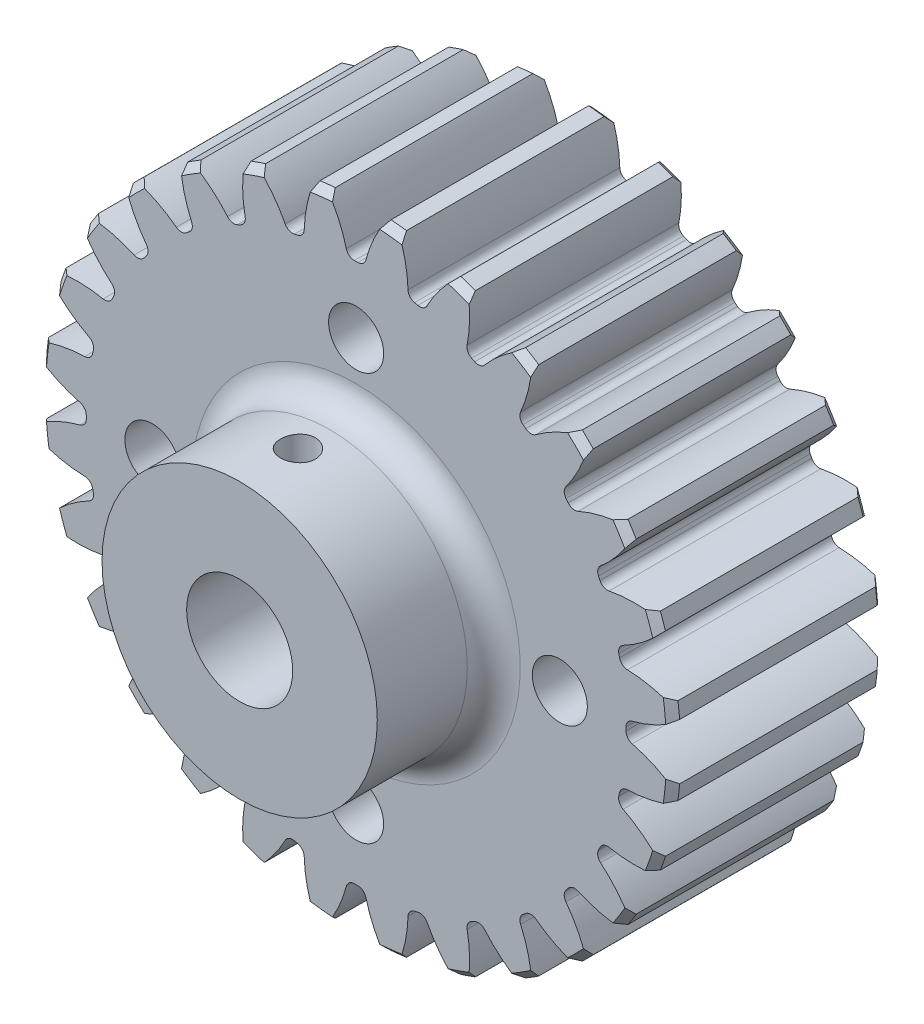
from build123d import *

# Parameters (mm, degrees)
BOSS_EXTRUDE1_DEPTH      = 16
BOSS_EXTRUDE1_DEPTH_BACK = 20
SKETCH3_R                = 30
SKETCH5_W                = 16
SKETCH5_H                = 7.5
SKETCH5_W_2              = 36
SKETCH5_H_2              = 6
FILLET2_R                = 0.671010072
CHAMFER1_SIZE            = 0.671010072
CUT_EXTRUDE1_DEPTH       = 47.904157598
FILLET1_R                = 0.785398163
CIRPATTERN1_COUNT        = 28
FILLET1_OF_CIRPATTERN1_R = 0.785398163
SKETCH6_R                = 6.671010072
SKETCH6_R_2              = 5.0075
BOSS_EXTRUDE2_DEPTH      = 36
SKETCH7_R                = 23.171010072
SKETCH7_R_2              = 13
CUT_EXTRUDE2_DEPTH       = 16
SKETCH8_R                = 2.6
CUT_EXTRUDE3_DEPTH       = 47.756278485
SKETCH7_2_R              = 13
SKETCH7_2_R_2            = 5.0075
CUT_EXTRUDE4_DEPTH       = 5
FILLET3_R                = 2.5
SKETCH12_W               = 1.65
SKETCH12_H               = 29.884356793


with BuildPart() as part:
    # Sketch3 → Boss-Extrude1 (new, two sides: drawn at the far end of the back side and taken through both)
    with BuildSketch(Plane.XY.offset(-BOSS_EXTRUDE1_DEPTH_BACK)):
        Circle(SKETCH3_R)
    extrude(amount=BOSS_EXTRUDE1_DEPTH + BOSS_EXTRUDE1_DEPTH_BACK)

    # Sketch5 → Cut-Revolve1 (revolve, cut)
    with BuildSketch(Plane(origin=(0, 0, 0), x_dir=(0, 0, -1), z_dir=(1, 0, 0)), mode=Mode.PRIVATE) as cut_revolve1_sk:
        with Locations((-8, 26.25)):
            Rectangle(SKETCH5_W, SKETCH5_H)
        with Locations((2, 3)):
            Rectangle(SKETCH5_W_2, SKETCH5_H_2)
    revolve(cut_revolve1_sk.sketch.rotate(Axis((0, 0, 16), (0, 0, -1)), 180), axis=Axis((0, 0, 16), (0, 0, -1)), mode=Mode.SUBTRACT)

    # Fillet2
    fillet2_edges = [part.edges().sort_by_distance(p)[0] for p in [
        (0, 22.5, 0),
    ]]
    fillet(fillet2_edges, radius=FILLET2_R)

    # Chamfer1
    chamfer1_edges = [part.edges().sort_by_distance(p)[0] for p in [
        (0, 6, 16),
        (0, 6, -20),
        (-30, 0, 0),
        (0, 22.5, 16),
        (-30, 0, -20),
    ]]
    chamfer(chamfer1_edges, length=CHAMFER1_SIZE)

    # Sketch4 → Cut-Extrude1 (cut, symmetric)
    with BuildSketch(Plane.XY):
        with BuildLine():
            Line((25.487902027, 0.785398163), (25.487902027, -0.785398163))
            ThreePointArc((25.487902027, -0.785398163), (27.774732862, -1.497491544), (29.884356793, -2.631581102))
            ThreePointArc((29.884356793, -2.631581102), (30, 0), (29.884356793, 2.631581102))
            ThreePointArc((29.884356793, 2.631581102), (27.774732862, 1.497491544), (25.487902027, 0.785398163))
        make_face()
    cut_extrude1 = extrude(amount=CUT_EXTRUDE1_DEPTH, both=True, mode=Mode.SUBTRACT)

    # Fillet1
    fillet1_edges = [part.edges().sort_by_distance(p)[0] for p in [
        (25.487902027, 0.785398163, -10),
        (25.487902027, -0.785398163, -10),
    ]]
    fillet(fillet1_edges, radius=FILLET1_R)

    # CirPattern1: Cut-Extrude1 ×28 about axis
    cirpattern1_axis = Axis((0, 0, 0), (0, 0, 1))
    for i in range(1, CIRPATTERN1_COUNT):
        add(cut_extrude1.rotate(cirpattern1_axis, i * 360 / CIRPATTERN1_COUNT), mode=Mode.SUBTRACT)

    # Fillet1 of CirPattern1
    fillet1_of_cirpattern1_edges = [part.edges().sort_by_distance(p)[0] for p in [
        (24.674099576, 6.437298355, -10),
        (25.023634642, 4.905885172, -10),
        (22.623034742, 11.766405528, -10),
        (23.304577726, 10.351166939, -10),
        (19.437556481, 16.505495995, -10),
        (20.416931972, 15.277397974, -10),
        (15.277397974, 20.416931972, -10),
        (16.505495995, 19.437556481, -10),
        (10.351166939, 23.304577726, -10),
        (11.766405528, 22.623034742, -10),
        (4.905885172, 25.023634642, -10),
        (6.437298355, 24.674099576, -10),
        (-0.785398163, 25.487902027, -10),
        (0.785398163, 25.487902027, -10),
        (-6.437298355, 24.674099576, -10),
        (-4.905885172, 25.023634642, -10),
        (-11.766405528, 22.623034742, -10),
        (-10.351166939, 23.304577726, -10),
        (-16.505495995, 19.437556481, -10),
        (-15.277397974, 20.416931972, -10),
        (-20.416931972, 15.277397974, -10),
        (-19.437556481, 16.505495995, -10),
        (-23.304577726, 10.351166939, -10),
        (-22.623034742, 11.766405528, -10),
        (-25.023634642, 4.905885172, -10),
        (-24.674099576, 6.437298355, -10),
        (-25.487902027, -0.785398163, -10),
        (-25.487902027, 0.785398163, -10),
        (-24.674099576, -6.437298355, -10),
        (-25.023634642, -4.905885172, -10),
        (-22.623034742, -11.766405528, -10),
        (-23.304577726, -10.351166939, -10),
        (-19.437556481, -16.505495995, -10),
        (-20.416931972, -15.277397974, -10),
        (-15.277397974, -20.416931972, -10),
        (-16.505495995, -19.437556481, -10),
        (-10.351166939, -23.304577726, -10),
        (-11.766405528, -22.623034742, -10),
        (-4.905885172, -25.023634642, -10),
        (-6.437298355, -24.674099576, -10),
        (0.785398163, -25.487902027, -10),
        (-0.785398163, -25.487902027, -10),
        (6.437298355, -24.674099576, -10),
        (4.905885172, -25.023634642, -10),
        (11.766405528, -22.623034742, -10),
        (10.351166939, -23.304577726, -10),
        (16.505495995, -19.437556481, -10),
        (15.277397974, -20.416931972, -10),
        (20.416931972, -15.277397974, -10),
        (19.437556481, -16.505495995, -10),
        (23.304577726, -10.351166939, -10),
        (22.623034742, -11.766405528, -10),
        (25.023634642, -4.905885172, -10),
        (24.674099576, -6.437298355, -10),
    ]]
    fillet(fillet1_of_cirpattern1_edges, radius=FILLET1_OF_CIRPATTERN1_R)

    # Sketch6 → Boss-Extrude2 (add, through all)
    with BuildSketch(Plane(origin=(0, 0, -20), x_dir=(-1, 0, 0), z_dir=(0, 0, -1))):
        Circle(SKETCH6_R)
        Circle(SKETCH6_R_2, mode=Mode.SUBTRACT)
    extrude(amount=-BOSS_EXTRUDE2_DEPTH)

    # Sketch7 → Cut-Extrude2 (cut)
    with BuildSketch(Plane.XY.offset(16)):
        Circle(SKETCH7_R)
        Circle(SKETCH7_R_2, mode=Mode.SUBTRACT)
    extrude(amount=-CUT_EXTRUDE2_DEPTH, mode=Mode.SUBTRACT)

    # Sketch8 → Cut-Extrude3 (cut, through all)
    with BuildSketch(Plane.XY):
        with Locations((0, 19.24)):
            Circle(SKETCH8_R)
        with Locations((19.24, 0)):
            Circle(SKETCH8_R)
        with Locations((0, -19.24)):
            Circle(SKETCH8_R)
        with Locations((-19.24, 0)):
            Circle(SKETCH8_R)
    extrude(amount=-CUT_EXTRUDE3_DEPTH, mode=Mode.SUBTRACT)

    # Sketch7<2> → Cut-Extrude4 (cut)
    with BuildSketch(Plane.XY.offset(16)):
        Circle(SKETCH7_2_R)
        with Locations(Location((0, 0, 0), (0, 0, 180))):
            Circle(SKETCH7_2_R_2, mode=Mode.SUBTRACT)
    extrude(amount=-CUT_EXTRUDE4_DEPTH, mode=Mode.SUBTRACT)

    # Fillet3
    fillet3_edges = [part.edges().sort_by_distance(p)[0] for p in [
        (-13, 0, 0),
    ]]
    fillet(fillet3_edges, radius=FILLET3_R)

    # Sketch12 → M4x0.7 Tapped Hole1 (revolve, cut)
    with BuildSketch(Plane(origin=(0, 0, 5.5), x_dir=(0, 0, -1), z_dir=(1, 0, 0))):
        with Locations((0.825, 14.942178397)):
            Rectangle(SKETCH12_W, SKETCH12_H)
    revolve(axis=Axis((0, -6.35, 5.5), (0, 1, 0)), mode=Mode.SUBTRACT)


solid = part.part
